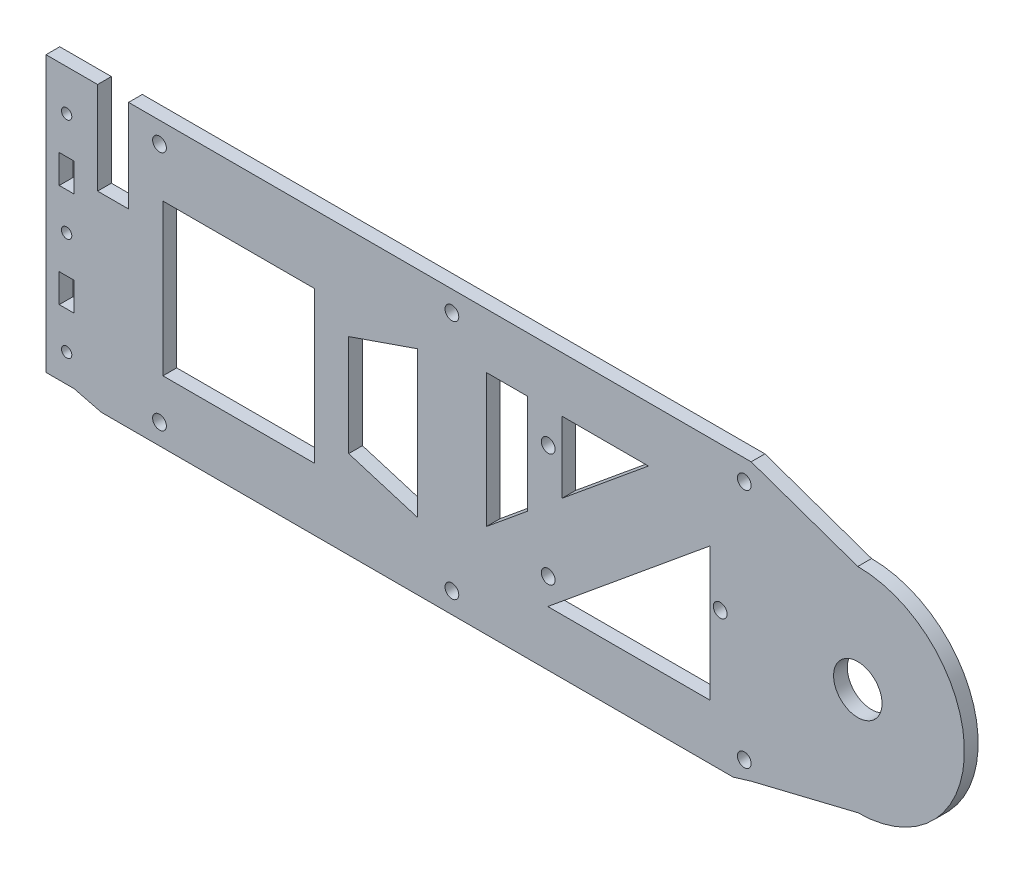
from build123d import *

# Parameters (mm, degrees)
EXTRUDE_1_OUTLINE_R   = 1.5
EXTRUDE_1_OUTLINE_W   = 4.3
EXTRUDE_1_OUTLINE_H   = 8.3
EXTRUDE_1_OUTLINE_R_2 = 11.5
EXTRUDE_1_OUTLINE_R_3 = 7.04
EXTRUDE_1_DEPTH       = 4
SKETCH_2_W            = 44
SKETCH_2_H            = 44
CUT_EXTRUDE_1_DEPTH   = 4
SKETCH_3_R            = 2
CUT_EXTRUDE_2_DEPTH   = 4
SKETCH_4_W            = 10
SKETCH_4_H            = 47.093490756
EXTRUDE_2_DEPTH       = 4
SKETCH_7_R            = 2
CUT_EXTRUDE_3_DEPTH   = 4


# Read off the part's stored shape, not the designer's step: 凸台-拉伸1
with BuildPart() as part:
    # 凸台-拉伸1 outline → 凸台-拉伸1 (new body)
    with BuildSketch(Plane.XY):
        with BuildLine():
            Line((174.542857143, -46.295714286), (199.556073527, -38.70591431))
            Line((199.556073527, -38.70591431), (230.542857143, -31.145714286))
            ThreePointArc((230.542857143, -31.145714286), (261.542857143, -0.145714286), (230.542857143, 30.854285714))
            Line((230.542857143, 30.854285714), (199.542857143, 41.704285714))
            Line((199.542857143, 41.704285714), (18.542857143, 41.704285714))
            Line((18.542857143, 41.704285714), (18.542857143, 14.854285714))
            Line((18.542857143, 14.854285714), (9.542857143, 14.854285714))
            Line((9.542857143, 14.854285714), (9.542857143, 41.704285714))
            Line((9.542857143, 41.704285714), (-5.457142857, 41.704285714))
            Line((-5.457142857, 41.704285714), (-5.457142857, -38.295714286))
            Line((-5.457142857, -38.295714286), (2.692857143, -38.295714286))
            Line((2.692857143, -38.295714286), (34.542857143, -46.295714286))
            Line((34.542857143, -46.295714286), (174.542857143, -46.295714286))
        make_face()
        with Locations((0.542857143, -30.145714286)):
            Circle(EXTRUDE_1_OUTLINE_R, mode=Mode.SUBTRACT)
        with Locations((0.542857143, -15.145714286)):
            Rectangle(EXTRUDE_1_OUTLINE_W, EXTRUDE_1_OUTLINE_H, mode=Mode.SUBTRACT)
        with Locations((50.542857143, -14.145714286)):
            Circle(EXTRUDE_1_OUTLINE_R, mode=Mode.SUBTRACT)
        with Locations((0.542857143, -0.145714286)):
            Circle(EXTRUDE_1_OUTLINE_R, mode=Mode.SUBTRACT)
        with Locations((36.542857143, -0.145714286)):
            Circle(EXTRUDE_1_OUTLINE_R, mode=Mode.SUBTRACT)
        with Locations((50.542857143, -0.145714286)):
            Circle(EXTRUDE_1_OUTLINE_R_2, mode=Mode.SUBTRACT)
        with Locations((0.542857143, 14.854285714)):
            Rectangle(EXTRUDE_1_OUTLINE_W, EXTRUDE_1_OUTLINE_H, mode=Mode.SUBTRACT)
        with Locations((50.542857143, 13.854285714)):
            Circle(EXTRUDE_1_OUTLINE_R, mode=Mode.SUBTRACT)
        with Locations((64.542857143, -0.145714286)):
            Circle(EXTRUDE_1_OUTLINE_R, mode=Mode.SUBTRACT)
        with Locations((0.542857143, 29.854285714)):
            Circle(EXTRUDE_1_OUTLINE_R, mode=Mode.SUBTRACT)
        with Locations((230.542857143, -0.145714286)):
            Circle(EXTRUDE_1_OUTLINE_R_3, mode=Mode.SUBTRACT)
    extrude(amount=EXTRUDE_1_DEPTH)

    # 草图2 → 切除-拉伸1 (cut)
    with BuildSketch(Plane.XY.offset(4)):
        with Locations((50.542857143, -0.145714286)):
            Rectangle(SKETCH_2_W, SKETCH_2_H)
    extrude(amount=-CUT_EXTRUDE_1_DEPTH, mode=Mode.SUBTRACT)

    # 草图3 → 切除-拉伸2 (cut)
    with BuildSketch(Plane.XY.offset(4)):
        with Locations((27.542857143, 35.704285714)):
            Circle(SKETCH_3_R)
        with Locations((112.542857143, 35.704285714)):
            Circle(SKETCH_3_R)
        with Locations((197.542857143, 35.704285714)):
            Circle(SKETCH_3_R)
        with Locations((112.542857143, -34.295714286)):
            Circle(SKETCH_3_R)
        with Locations((197.542857143, -34.295714286)):
            Circle(SKETCH_3_R)
        with Locations((27.542857143, -34.295714286)):
            Circle(SKETCH_3_R)
        Polygon((187.542857143, -24.295714286), (140.41622539, -24.295714286), (187.542857143, 14.51445304), align=None)
        Polygon((122.542857143, 25.704285714), (169.669488896, 25.704285714), (122.542857143, -13.105881612), align=None)
        Polygon((82.542857143, 14.734304613), (102.542857143, 21.659304613), (102.542857143, -20.807070509), (82.542857143, -14.732070509), align=None)
    extrude(amount=-CUT_EXTRUDE_2_DEPTH, mode=Mode.SUBTRACT)

    # 草图4 → 凸台-拉伸2 (add)
    with BuildSketch(Plane.XY.offset(4)):
        with Locations((139.542857143, 15.704285714)):
            Rectangle(SKETCH_4_W, SKETCH_4_H)
    extrude(amount=-EXTRUDE_2_DEPTH)

    # 草图7 → 切除-拉伸3 (cut)
    with BuildSketch(Plane.XY.offset(4)):
        with Locations((190.542857143, -0.145714286)):
            Circle(SKETCH_7_R)
        with Locations((140.542857143, 16.354285714)):
            Circle(SKETCH_7_R)
        with Locations(Location((140.542857143, -16.645714286, 0), (0, 0, 180))):
            Circle(SKETCH_7_R)
        Polygon((10.655357143, -40.295714286), (194.316671838, -40.295714286), (206.19710926, -67.618852766), (10.655357143, -65.874099546), align=None)
    extrude(amount=-CUT_EXTRUDE_3_DEPTH, mode=Mode.SUBTRACT)


solid = part.part
